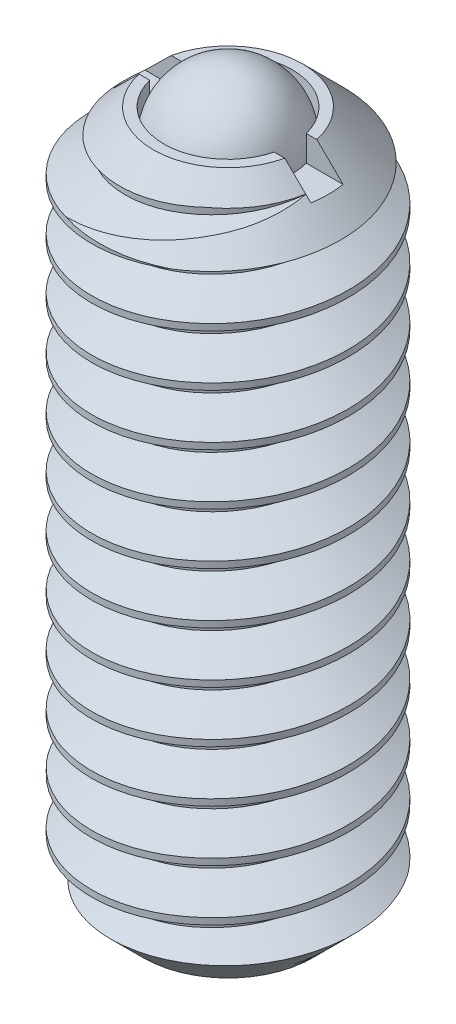
from build123d import *
from build123d.topology import SkipClean

# Parameters (mm, degrees)
SKETCH24_W               = 3.175
SKETCH24_H               = 17.145
CUT_SWEEP1_PITCH         = 1.27
SKETCH26_W               = 1.5875
SKETCH26_H               = 15.1384
CUT_EXTRUDE11_DEPTH      = 10.67724182
CUT_EXTRUDE11_DEPTH_BACK = 10.67724182
SKETCH28_W               = 0.79375
SKETCH28_H               = 0.635
EXTRUDE12_DEPTH          = 1.0033


with BuildPart() as part:
    # Sketch24 → Revolve1 (revolve)
    with BuildSketch(Plane(origin=(0, 0, 0), x_dir=(0, 0, -1), z_dir=(1, 0, 0)), mode=Mode.PRIVATE) as revolve1_sk:
        with Locations((1.5875, 0)):
            Rectangle(SKETCH24_W, SKETCH24_H)
    revolve(revolve1_sk.sketch.rotate(Axis((0, 8.5725, 0), (0, -1, 0)), 180), axis=Axis((0, 8.5725, 0), (0, -1, 0)))

    # Cut-Sweep1: the profile of Sketch38 profile screwed along a right-hand helix of 14.5 turns, 8 arcs to a turn; built about Z, then put on its axis
    cut_sweep1_z = Axis((0, 0, 0), (0, 0, 1))
    cut_sweep1_corners = [(3.1753, 0, -1.111423205), (3.1753, 0, 0.000173205), (2.350110803, 0, -0.47625), (2.350110803, 0, -0.635)]
    with BuildLine(mode=Mode.PRIVATE) as cut_sweep1_profile:
        Line(cut_sweep1_corners[0], cut_sweep1_corners[1])
        Line(cut_sweep1_corners[1], cut_sweep1_corners[2])
        Line(cut_sweep1_corners[2], cut_sweep1_corners[3])
        Line(cut_sweep1_corners[3], cut_sweep1_corners[0])
    cut_sweep1_cap = Face(cut_sweep1_profile.wire())
    cut_sweep1_turn_angles = [0, 22.5, 45, 67.5, 90, 112.5, 135, 157.5, 180, 202.5, 225, 247.5, 270, 292.5, 315, 337.5, 360]
    cut_sweep1_turn_weights = [1, 0.9238795325112867, 1, 0.9238795325112867, 1, 0.9238795325112867, 1, 0.9238795325112867, 1, 0.9238795325112867, 1, 0.9238795325112867, 1, 0.9238795325112867, 1, 0.9238795325112867, 1]
    cut_sweep1_turn_rails = [Edge.make_bspline([Vector(p[0], p[1], 0).rotate(cut_sweep1_z, cut_sweep1_turn_angles[k]) / cut_sweep1_turn_weights[k] + Vector(0, 0, p[2] + CUT_SWEEP1_PITCH * cut_sweep1_turn_angles[k] / 360) for k in range(17)], [0, 0, 0, 1, 1, 2, 2, 3, 3, 4, 4, 5, 5, 6, 6, 7, 7, 8, 8, 8], 2, cut_sweep1_turn_weights) for p in cut_sweep1_corners]
    cut_sweep1_turn_sides = [Face.make_surface_from_curves(cut_sweep1_turn_rails[p[0]], cut_sweep1_turn_rails[p[1]]) for p in [(0, 1), (1, 2), (2, 3), (3, 0)]]
    cut_sweep1_last_angles = [5040, 5062.5, 5085, 5107.5, 5130, 5152.5, 5175, 5197.5, 5220]
    cut_sweep1_last_weights = [1, 0.9238795325112867, 1, 0.9238795325112867, 1, 0.9238795325112867, 1, 0.9238795325112564, 1]
    cut_sweep1_last_rails = [Edge.make_bspline([Vector(p[0], p[1], 0).rotate(cut_sweep1_z, cut_sweep1_last_angles[k]) / cut_sweep1_last_weights[k] + Vector(0, 0, p[2] + CUT_SWEEP1_PITCH * cut_sweep1_last_angles[k] / 360) for k in range(9)], [0, 0, 0, 1, 1, 2, 2, 3, 3, 4, 4, 4], 2, cut_sweep1_last_weights) for p in cut_sweep1_corners]
    cut_sweep1_last_sides = [Face.make_surface_from_curves(cut_sweep1_last_rails[p[0]], cut_sweep1_last_rails[p[1]]) for p in [(0, 1), (1, 2), (2, 3), (3, 0)]]
    cut_sweep1 = Plane(origin=(0, 8.5725, 0), x_dir=(0, 0, 1), z_dir=(0, -1, 0)) * Solid(Shell([*[p.moved(Location((0, 0, CUT_SWEEP1_PITCH * i))) for i in range(14) for p in cut_sweep1_turn_sides], *cut_sweep1_last_sides, cut_sweep1_cap, cut_sweep1_cap.rotate(cut_sweep1_z, 5220).moved(Location((0, 0, CUT_SWEEP1_PITCH * 5220 / 360)))]))
    add(cut_sweep1, mode=Mode.SUBTRACT)

    # Sketch26 → Cut-Revolve10 (revolve, cut)
    with BuildSketch(Plane(origin=(0, 0, 0), x_dir=(0, 0, -1), z_dir=(1, 0, 0))):
        with Locations((0.79375, 1.0033)):
            Rectangle(SKETCH26_W, SKETCH26_H)
    revolve(axis=Axis((0, -6.5659, 0), (0, 1, 0)), mode=Mode.SUBTRACT)

    # Sketch31 → Cut-Revolve13 (revolve, cut)
    with SkipClean():  # the faces are left unmerged after this step: merging them gives an invalid solid
        with BuildSketch(Plane(origin=(0, 0, 0), x_dir=(0, 0, -1), z_dir=(1, 0, 0)), mode=Mode.PRIVATE) as cut_revolve13_sk:
            Polygon((3.175, -8.5725), (2.0955, -8.5725), (3.175, -7.493), align=None)
            Polygon((3.175, 8.5725), (1.8415, 8.5725), (3.175, 7.239), align=None)
        revolve(cut_revolve13_sk.sketch.rotate(Axis((0, 8.5725, 0), (0, -1, 0)), 99.39917973), axis=Axis((0, 8.5725, 0), (0, -1, 0)), mode=Mode.SUBTRACT)

    # Sketch28 → Cut-Extrude11 (cut, two sides: drawn at the far end of the back side and taken through both)
    with BuildSketch(Plane(origin=(0, 0, 0), x_dir=(0, 0, -1), z_dir=(1, 0, 0)).offset(-CUT_EXTRUDE11_DEPTH_BACK)):
        with Locations((0, 8.255)):
            Rectangle(SKETCH28_W, SKETCH28_H)
    extrude(amount=CUT_EXTRUDE11_DEPTH + CUT_EXTRUDE11_DEPTH_BACK, mode=Mode.SUBTRACT)

    # Sketch46 → Extrude12 (cut)
    with BuildSketch(Plane.XZ.offset(8.5725)):
        Polygon((-1.0033, 0.579255525), (-1.0033, -0.579255525), (0, -1.15851105), (1.0033, -0.579255525), (1.0033, 0.579255525), (0, 1.15851105), align=None)
    extrude(amount=-EXTRUDE12_DEPTH, mode=Mode.SUBTRACT)

    # Extrude13 cone 1 section (through the dimple's axis) → Extrude13 (revolve, cut)
    with BuildSketch(Plane(origin=(0, -8.5725, 0), x_dir=(0, 0, -1), z_dir=(1, 0, 0))):
        Polygon((0, 0), (1.15851105, 0), (0, 0.668866667), align=None)
    revolve(axis=Axis((0, -8.5725, 0), (0, 1, 0)), mode=Mode.SUBTRACT)


with BuildPart() as body_2:
    # Sketch27 → Revolve2 (revolve)
    with BuildSketch(Plane(origin=(0, 0, 0), x_dir=(0, 0, -1), z_dir=(1, 0, 0))):
        with BuildLine():
            Line((0, 9.4615), (0, 6.2865))
            ThreePointArc((0, 6.2865), (1.5875, 7.874), (0, 9.4615))
        make_face()
    revolve(axis=Axis((0, 9.4615, 0), (0, -1, 0)))


solid = Compound([part.part, body_2.part])
